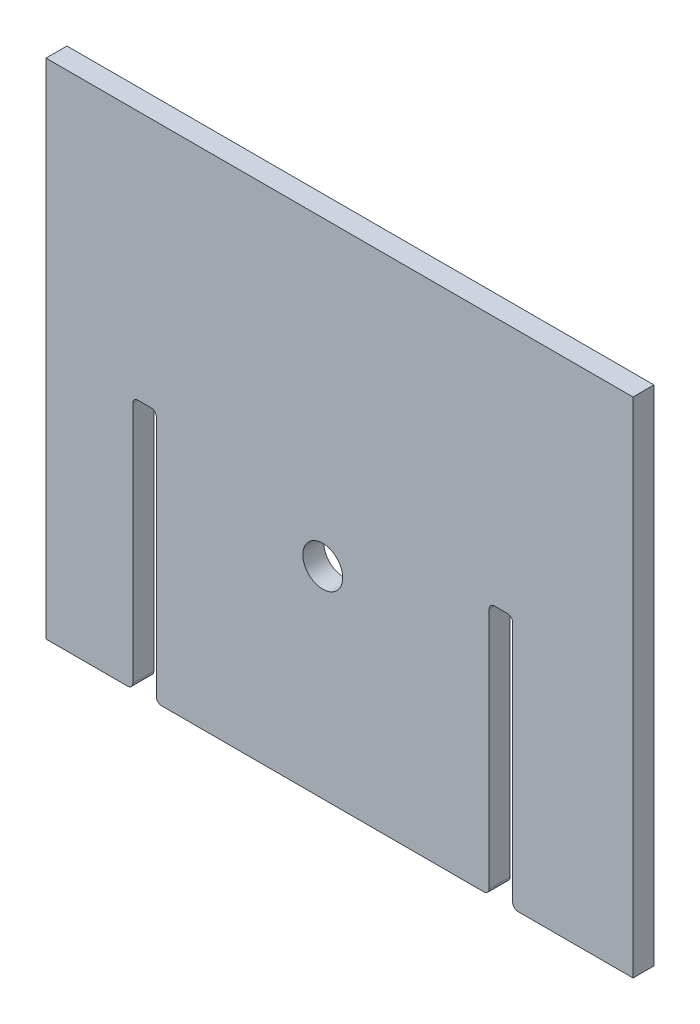
from build123d import *

# Parameters (mm, degrees)
BOSS_EXTRUDE1_DEPTH = 6.35
CAVITY1_START       = -6.35
CAVITY1_OUTLINE_R   = 12.7
CAVITY1_DEPTH       = 12.7
MOVE_FACE_SLOT_BY   = 0.762
MOVE_FACE_SLOT_2_BY = 0.762
MOVE_FACE_SLOT_3_BY = 0.762
MOVE_FACE_SLOT_4_BY = 0.762
MOVE_FACE_SLOT_5_BY = 0.762
MOVE_FACE_SLOT_6_BY = 0.762
MOVE_FACE_HOLE_BY   = 0.635
SLOT_FILLET_R       = 3.175


# Read off the part's stored shape, not the designer's step: Cavity1
with BuildPart() as part:
    # Sketch1 → Boss-Extrude1 (new, symmetric)
    with BuildSketch(Plane.XY):
        Polygon((785.7, 533.4), (785.7, 381), (732.36, 381), (732.36, 685.8), (785.7, 685.8), (1001.6, 685.8), (1087.96, 685.8), (1087.96, 381), (1014.3, 381), (1014.3, 533.4), (1001.6, 533.4), (1001.6, 381), (798.4, 381), (798.4, 533.4), align=None)
    extrude(amount=BOSS_EXTRUDE1_DEPTH, both=True)

    # Cavity1 outline → Cavity1 (cut)
    with BuildSketch(Plane.XY.offset(CAVITY1_START)):
        with Locations((900, 503.049546279)):
            Circle(CAVITY1_OUTLINE_R)
    extrude(amount=CAVITY1_DEPTH, mode=Mode.SUBTRACT)

    # Move Face Slot: a face moved inward by 0.762
    extrude(part.faces().sort_by_distance((1007.95, 533.4, 0))[0], amount=MOVE_FACE_SLOT_BY, dir=(0, 1, 0), mode=Mode.SUBTRACT)

    # Move Face Slot 2: a face moved inward by 0.762
    extrude(part.faces().sort_by_distance((1014.3, 457.2, 0))[0], amount=MOVE_FACE_SLOT_2_BY, dir=(1, 0, 0), mode=Mode.SUBTRACT)

    # Move Face Slot 3: a face moved inward by 0.762
    extrude(part.faces().sort_by_distance((792.05, 533.4, 0))[0], amount=MOVE_FACE_SLOT_3_BY, dir=(0, 1, 0), mode=Mode.SUBTRACT)

    # Move Face Slot 4: a face moved inward by 0.762
    extrude(part.faces().sort_by_distance((798.4, 457.2, 0))[0], amount=MOVE_FACE_SLOT_4_BY, dir=(1, 0, 0), mode=Mode.SUBTRACT)

    # Move Face Slot 5: a face moved inward by 0.762
    extrude(part.faces().sort_by_distance((785.7, 457.2, 0))[0], amount=MOVE_FACE_SLOT_5_BY, dir=(-1, 0, 0), mode=Mode.SUBTRACT)

    # Move Face Slot 6: a face moved inward by 0.762
    extrude(part.faces().sort_by_distance((1001.6, 457.2, 0))[0], amount=MOVE_FACE_SLOT_6_BY, dir=(-1, 0, 0), mode=Mode.SUBTRACT)

    # Move Face Hole: a curved face moved outward by 0.635
    add(Solid.thicken(part.faces().sort_by_distance((887.3, 503.049546279, 0))[0], MOVE_FACE_HOLE_BY))

    # Slot Fillet
    slot_fillet_edges = [part.edges().sort_by_distance(p)[0] for p in [
        (784.938, 381, 0),
        (784.938, 534.162, 0),
        (799.162, 534.162, 0),
        (799.162, 381, 0),
        (1000.838, 381, 0),
        (1000.838, 534.162, 0),
        (1015.062, 534.162, 0),
        (1015.062, 381, 0),
    ]]
    fillet(slot_fillet_edges, radius=SLOT_FILLET_R)


solid = part.part
